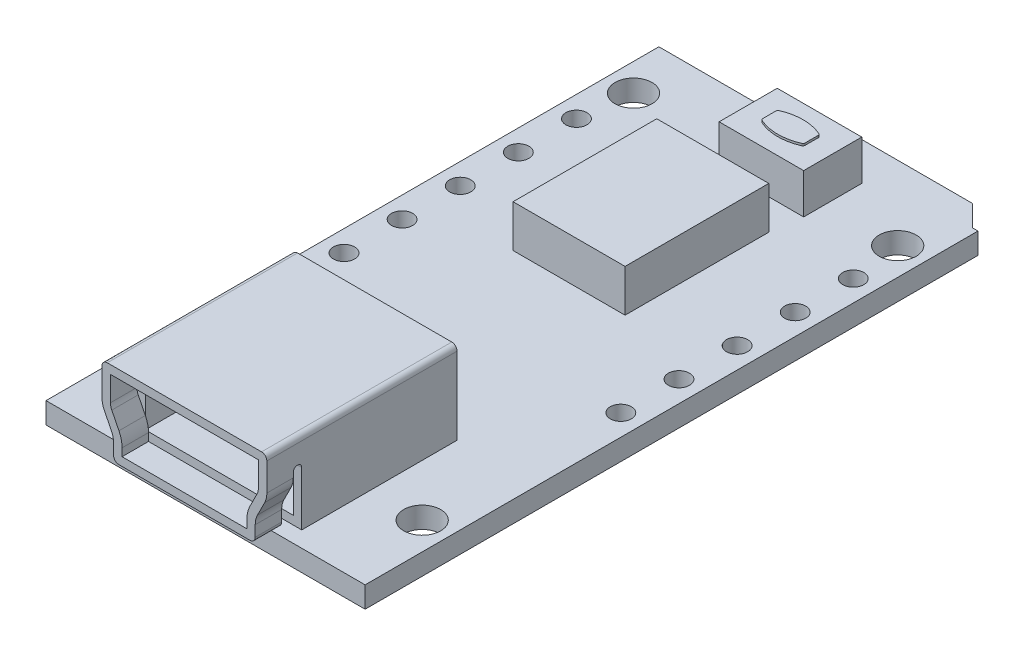
from build123d import *

# Parameters (mm, degrees)
SKETCH1_R                = 0.875
SKETCH1_R_2              = 0.5
BOSS_EXTRUDE1_DEPTH      = 1
BOSS_EXTRUDE2_DEPTH      = 1
BOSS_EXTRUDE2_DEPTH_BACK = 0.25
SKETCH3_W                = 7.8
SKETCH3_H                = 3.9
BOSS_EXTRUDE3_DEPTH      = 7.75
FILLET1_R                = 0.25
FILLET2_R                = 1
SHELL1_START             = 7.4
SHELL1_DEPTH             = 8.6
SHELL1_2_DEPTH           = 6.95
CUT_EXTRUDE1_DEPTH       = 8.75
SKETCH6_W                = 5.3
SKETCH6_H                = 6.8
BOSS_EXTRUDE4_DEPTH      = 2
SKETCH7_W                = 4
SKETCH7_H                = 2.75
BOSS_EXTRUDE5_DEPTH      = 1.9
BOSS_EXTRUDE6_DEPTH      = 0.1
FILLET3_R                = 0.1


# Read off the part's stored shape, not the designer's step: Shell1
with BuildPart() as part:
    # Sketch1 → Boss-Extrude1 (new body)
    with BuildSketch(Plane(origin=(0, 0, 0), x_dir=(1, 0, 0), z_dir=(0, 1, 0))):
        Polygon((-7.55, 14), (-1.95, 14), (-0.95, 15), (6.3, 15), (7.3, 14), (7.55, 14), (7.55, -15), (-7.55, -15), align=None)
        with Locations(Location((-6.25, 11.5, 0), (0, 0, 270))):
            Circle(SKETCH1_R, mode=Mode.SUBTRACT)
        with Locations(Location((6.25, 11.5, 0), (0, 0, 270))):
            Circle(SKETCH1_R, mode=Mode.SUBTRACT)
        with Locations(Location((-6.25, -11, 0), (0, 0, 270))):
            Circle(SKETCH1_R, mode=Mode.SUBTRACT)
        with Locations(Location((6.25, -11, 0), (0, 0, 270))):
            Circle(SKETCH1_R, mode=Mode.SUBTRACT)
        with Locations(Location((-6.55, 9.1, 0), (0, 0, 270))):
            Circle(SKETCH1_R_2, mode=Mode.SUBTRACT)
        with Locations(Location((-6.55, -1.9, 0), (0, 0, 270))):
            Circle(SKETCH1_R_2, mode=Mode.SUBTRACT)
        with Locations(Location((-6.55, 3.6, 0), (0, 0, 270))):
            Circle(SKETCH1_R_2, mode=Mode.SUBTRACT)
        with Locations(Location((-6.55, 6.35, 0), (0, 0, 270))):
            Circle(SKETCH1_R_2, mode=Mode.SUBTRACT)
        with Locations(Location((-6.55, 0.85, 0), (0, 0, 270))):
            Circle(SKETCH1_R_2, mode=Mode.SUBTRACT)
        with Locations(Location((6.55, -1.9, 0), (0, 0, 90))):
            Circle(SKETCH1_R_2, mode=Mode.SUBTRACT)
        with Locations(Location((6.55, 0.85, 0), (0, 0, 90))):
            Circle(SKETCH1_R_2, mode=Mode.SUBTRACT)
        with Locations(Location((6.55, 3.6, 0), (0, 0, 90))):
            Circle(SKETCH1_R_2, mode=Mode.SUBTRACT)
        with Locations(Location((6.55, 6.35, 0), (0, 0, 90))):
            Circle(SKETCH1_R_2, mode=Mode.SUBTRACT)
        with Locations(Location((6.55, 9.1, 0), (0, 0, 90))):
            Circle(SKETCH1_R_2, mode=Mode.SUBTRACT)
    extrude(amount=BOSS_EXTRUDE1_DEPTH)


with BuildPart() as body_2:
    # Sketch2 → Boss-Extrude2 (new, two sides: drawn at the far end of the back side and taken through both)
    with BuildSketch(Plane.XY.offset(15).offset(-BOSS_EXTRUDE2_DEPTH_BACK)):
        Polygon((3.35, 1.1), (3.35, 2.1), (3.9, 3.2), (3.9, 5), (-3.9, 5), (-3.9, 3.2), (-3.35, 2.1), (-3.35, 1.1), align=None)
    extrude(amount=BOSS_EXTRUDE2_DEPTH + BOSS_EXTRUDE2_DEPTH_BACK)

    # Sketch3 → Boss-Extrude3 (add)
    with BuildSketch(Plane(origin=(0, 0, 14.75), x_dir=(-1, 0, 0), z_dir=(0, 0, -1))):
        with Locations((0, 3.05)):
            Rectangle(SKETCH3_W, SKETCH3_H)
    extrude(amount=BOSS_EXTRUDE3_DEPTH)

    # Fillet1
    fillet1_edges = [body_2.edges().sort_by_distance(p)[0] for p in [
        (3.35, 1.1, 15.375),
        (-3.35, 1.1, 15.375),
        (3.9, 5, 11.5),
        (-3.9, 5, 11.5),
    ]]
    fillet(fillet1_edges, radius=FILLET1_R)

    # Fillet2
    fillet2_edges = [body_2.edges().sort_by_distance(p)[0] for p in [
        (3.9, 3.2, 15.375),
        (3.35, 2.1, 15.375),
        (-3.35, 2.1, 15.375),
        (-3.9, 3.2, 15.375),
    ]]
    fillet(fillet2_edges, radius=FILLET2_R)

    # Shell1 outline → Shell1 (cut)
    with BuildSketch(Plane.XY.offset(SHELL1_START)):
        with BuildLine():
            Line((-2.95, 1.863932023), (-2.95, 1.5))
            Line((-2.95, 1.5), (2.95, 1.5))
            Line((2.95, 1.5), (2.95, 1.863932023))
            ThreePointArc((2.95, 1.863932023), (2.987451415, 2.185586111), (3.097801933, 2.490031056))
            Line((3.097801933, 2.490031056), (3.436656315, 3.16773982))
            ThreePointArc((3.436656315, 3.16773982), (3.483949394, 3.298216225), (3.5, 3.436067977))
            Line((3.5, 3.436067977), (3.5, 4.6))
            Line((3.5, 4.6), (-3.5, 4.6))
            Line((-3.5, 4.6), (-3.5, 3.436067977))
            ThreePointArc((-3.5, 3.436067977), (-3.483949394, 3.298216225), (-3.436656315, 3.16773982))
            Line((-3.436656315, 3.16773982), (-3.097801933, 2.490031056))
            ThreePointArc((-3.097801933, 2.490031056), (-2.987451415, 2.185586111), (-2.95, 1.863932023))
        make_face()
    extrude(amount=SHELL1_DEPTH, mode=Mode.SUBTRACT)

    # Shell1 2 outline → Shell1 2 (cut)
    with BuildSketch(Plane.XY.offset(SHELL1_START)):
        with BuildLine():
            Line((-3.5, 3.436067977), (-3.5, 1.5))
            Line((-3.5, 1.5), (-2.95, 1.5))
            Line((-2.95, 1.5), (-2.95, 1.863932023))
            ThreePointArc((-2.95, 1.863932023), (-2.987451415, 2.185586111), (-3.097801933, 2.490031056))
            Line((-3.097801933, 2.490031056), (-3.436656315, 3.16773982))
            ThreePointArc((-3.436656315, 3.16773982), (-3.483949394, 3.298216225), (-3.5, 3.436067977))
        make_face()
        with BuildLine():
            Line((2.95, 1.863932023), (2.95, 1.5))
            Line((2.95, 1.5), (3.5, 1.5))
            Line((3.5, 1.5), (3.5, 3.436067977))
            ThreePointArc((3.5, 3.436067977), (3.483949394, 3.298216225), (3.436656315, 3.16773982))
            Line((3.436656315, 3.16773982), (3.097801933, 2.490031056))
            ThreePointArc((3.097801933, 2.490031056), (2.987451415, 2.185586111), (2.95, 1.863932023))
        make_face()
    extrude(amount=SHELL1_2_DEPTH, mode=Mode.SUBTRACT)

    # Sketch5 → Cut-Extrude1 (cut)
    with BuildSketch(Plane(origin=(3.9, 0, 0), x_dir=(0, 0, -1), z_dir=(1, 0, 0))):
        with BuildLine():
            Line((-14.75, 1.1), (-14.35, 1.1))
            Line((-14.35, 1.1), (-14.35, 3.66))
            ThreePointArc((-14.35, 3.66), (-14.405649712, 3.794350288), (-14.54, 3.85))
            Line((-14.54, 3.85), (-14.56, 3.85))
            ThreePointArc((-14.56, 3.85), (-14.694350288, 3.794350288), (-14.75, 3.66))
            Line((-14.75, 3.66), (-14.75, 1.1))
        make_face()
    extrude(amount=-CUT_EXTRUDE1_DEPTH, mode=Mode.SUBTRACT)


with BuildPart() as body_3:
    # Sketch6 → Boss-Extrude4 (new body)
    with BuildSketch(Plane(origin=(0, 1, 0), x_dir=(1, 0, 0), z_dir=(0, 1, 0))):
        with Locations((0, 5.6)):
            Rectangle(SKETCH6_W, SKETCH6_H)
    extrude(amount=BOSS_EXTRUDE4_DEPTH)


with BuildPart() as body_4:
    # Sketch7 → Boss-Extrude5 (new body)
    with BuildSketch(Plane(origin=(0, 1, 0), x_dir=(1, 0, 0), z_dir=(0, 1, 0))):
        with Locations((0.85, 11.825)):
            Rectangle(SKETCH7_W, SKETCH7_H)
    extrude(amount=BOSS_EXTRUDE5_DEPTH)


with BuildPart() as body_5:
    # Sketch8 → Boss-Extrude6 (new body)
    with BuildSketch(Plane(origin=(0, 2.9, 0), x_dir=(1, 0, 0), z_dir=(0, 1, 0))):
        with BuildLine():
            Line((-0.15, 12.2), (-0.15, 11.45))
            ThreePointArc((-0.15, 11.45), (0.85, 11.225), (1.85, 11.45))
            Line((1.85, 11.45), (1.85, 12.2))
            ThreePointArc((1.85, 12.2), (0.85, 12.425), (-0.15, 12.2))
        make_face()
    extrude(amount=BOSS_EXTRUDE6_DEPTH)

    # Fillet3
    fillet3_edges = [body_5.edges().sort_by_distance(p)[0] for p in [
        (1.85, 2.95, -12.2),
        (1.85, 2.95, -11.45),
        (-0.15, 2.95, -11.45),
        (-0.15, 2.95, -12.2),
    ]]
    fillet(fillet3_edges, radius=FILLET3_R)


solid = Compound([part.part, body_2.part, body_3.part, body_4.part, body_5.part])
